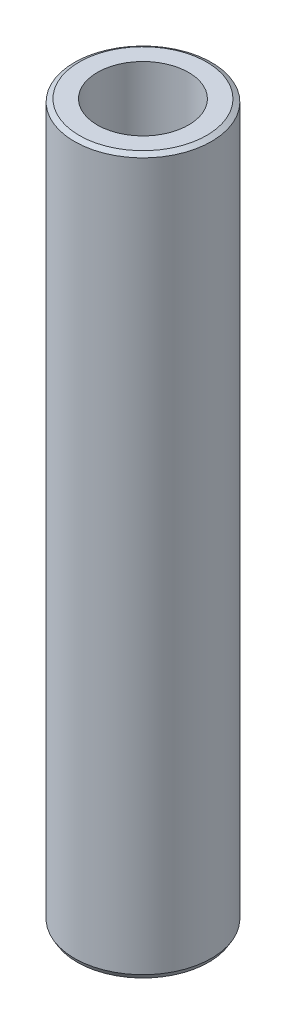
from build123d import *
from OCP.BRepFilletAPI import BRepFilletAPI_MakeChamfer

# Parameters (mm, degrees)
SKETCH1_R           = 57.5
BOSS_EXTRUDE1_DEPTH = 600
SKETCH2_R           = 38.269416779
CUT_EXTRUDE1_DEPTH  = 606.485342515
CHAMFER1_SIZE       = 2.348189211
CHAMFER1_SIZE2      = 4.06718302


with BuildPart() as part:
    # Sketch1 → Boss-Extrude1 (new body)
    with BuildSketch(Plane(origin=(0, 0, 0), x_dir=(1, 0, 0), z_dir=(0, 1, 0))):
        Circle(SKETCH1_R)
    extrude(amount=BOSS_EXTRUDE1_DEPTH)

    # Sketch2 → Cut-Extrude1 (cut, through all)
    with BuildSketch(Plane(origin=(0, 0, 0), x_dir=(1, 0, 0), z_dir=(0, 1, 0))):
        Circle(SKETCH2_R)
    extrude(amount=CUT_EXTRUDE1_DEPTH, mode=Mode.SUBTRACT)

    # Chamfer1: one chamfer whose edges measure the first distance from different faces: ONE call of the kernel's chamfer builder (chamfer() names one face for all edges)
    chamfer1_edges_1 = [part.edges().sort_by_distance(p)[0] for p in [
        (-57.5, 600, 0),
    ]]
    chamfer1_side_1 = [part.faces().sort_by_distance(p)[0] for p in [
        (-57.5, 300, 0),
    ]]
    chamfer1_edges_2 = [part.edges().sort_by_distance(p)[0] for p in [
        (-57.5, 0, 0),
    ]]
    chamfer1_side_2 = [part.faces().sort_by_distance(p)[0] for p in [
        (-55.873654403, 0, 0),
    ]]
    chamfer1 = BRepFilletAPI_MakeChamfer(part.part.solid().wrapped)
    for e in chamfer1_edges_1:
        chamfer1.Add(CHAMFER1_SIZE, CHAMFER1_SIZE2, e.wrapped, chamfer1_side_1[0].wrapped)  # the first distance lies on this face
    for e in chamfer1_edges_2:
        chamfer1.Add(CHAMFER1_SIZE, CHAMFER1_SIZE2, e.wrapped, chamfer1_side_2[0].wrapped)  # the first distance lies on this face
    add(Compound.cast(chamfer1.Shape()), mode=Mode.REPLACE)


solid = part.part
